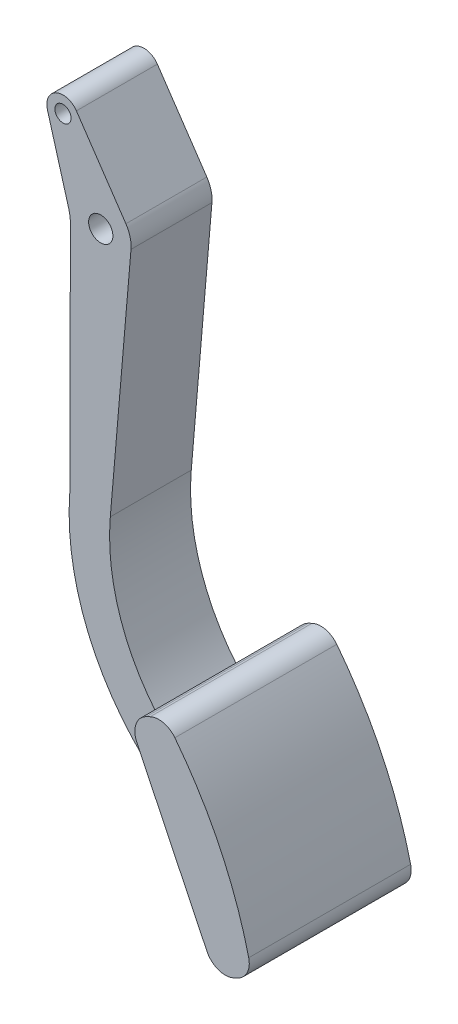
from build123d import *

# Parameters (mm, degrees)
BOSS_EXTRUDE3_DEPTH = 10
BOSS_EXTRUDE4_DEPTH = 20
SKETCH2_R           = 2
SKETCH2_R_2         = 3
CUT_EXTRUDE1_DEPTH  = 40
FILLET3_R           = 10
FILLET4_R           = 10
FILLET5_R           = 5
FILLET6_R           = 5
FILLET7_R           = 5
FILLET8_R           = 5


with BuildPart() as part:
    # Sketch1 → Boss-Extrude3 (new, symmetric)
    with BuildSketch(Plane.XY):
        with BuildLine():
            Line((-6.014924663, 62.244051207), (6.208553437, 44.207596014))
            ThreePointArc((6.208553437, 44.207596014), (7.257156315, 41.893061598), (7.472748917, 39.361232736))
            Line((7.472748917, 39.361232736), (2.362176037, -20.425844843))
            ThreePointArc((2.362176037, -20.425844843), (7.015315923, -46.134373754), (24, -65.986342835))
            Line((24, -65.986342835), (31.161941742, -80.882336991))
            ThreePointArc((31.161941742, -80.882336991), (1.523988114, -56.838882139), (-7.619240262, -19.78625212))
            Line((-7.619240262, -19.78625212), (-7.50208553, 38.961677125))
            Line((-7.50208553, 38.961677125), (-13.173612773, 58.905900119))
            ThreePointArc((-13.173612773, 58.905900119), (-11.01662621, 63.625231148), (-6.014924663, 62.244051207))
        make_face()
        with BuildLine():
            Line((-7.499985087, 40.014956421), (-7.500014913, 40))
            ThreePointArc((-7.500014913, 40), (-7.499996272, 40.007478214), (-7.499985087, 40.014956421))
        make_face(mode=Mode.SUBTRACT)
    extrude(amount=BOSS_EXTRUDE3_DEPTH, both=True)

    # Sketch1<4> → Boss-Extrude4 (add, symmetric)
    with BuildSketch(Plane.XY):
        with BuildLine():
            ThreePointArc((25.760539384, -46.570125255), (39.455220381, -67.725242398), (47.426258953, -91.632266743))
            Line((47.426258953, -91.632266743), (38.413830656, -95.965410657))
            Line((38.413830656, -95.965410657), (31.161941742, -80.882336991))
            Line((31.161941742, -80.882336991), (24, -65.986342835))
            Line((24, -65.986342835), (16.748111086, -50.903269169))
            Line((16.748111086, -50.903269169), (25.760539384, -46.570125255))
        make_face()
    extrude(amount=BOSS_EXTRUDE4_DEPTH, both=True)

    # Sketch2 → Cut-Extrude1 (cut)
    with BuildSketch(Plane.XY.offset(10)):
        with Locations((-9.326153163, 60)):
            Circle(SKETCH2_R)
        with Locations((0, 40)):
            Circle(SKETCH2_R_2)
    extrude(amount=-CUT_EXTRUDE1_DEPTH, mode=Mode.SUBTRACT)

    # Fillet3
    fillet3_edges = [part.edges().sort_by_distance(p)[0] for p in [
        (-7.50208553, 38.961677125, 0),
    ]]
    fillet(fillet3_edges, radius=FILLET3_R)

    # Fillet4
    # the kernel refuses this fillet: 10 mm, written as the material it adds along each edge
    with BuildSketch(Plane(origin=(-7.619240262, -19.78625212, -10), x_dir=(0.0019941894265581785, 0.9999980116022886, 0), z_dir=(0, 0, 1))) as fillet4_piece_1:
        with BuildLine():
            CenterArc((0.38347882, 10), FILLET4_R, 265.770794781, 4.229205219)
            ThreePointArc((-0.353986639, 0.027229838), (-0.176973179, 0.013876746), (0, 0))
            Line((0, 0), (0.38347882, 0))
        make_face()
    extrude(amount=20)

    # Fillet5
    fillet5_edges = [part.edges().sort_by_distance(p)[0] for p in [
        (25.760539384, -46.570125255, 0),
    ]]
    fillet(fillet5_edges, radius=FILLET5_R)

    # Fillet6
    fillet6_edges = [part.edges().sort_by_distance(p)[0] for p in [
        (47.426258953, -91.632266743, 0),
    ]]
    fillet(fillet6_edges, radius=FILLET6_R)

    # Fillet7
    fillet7_edges = [part.edges().sort_by_distance(p)[0] for p in [
        (16.748111086, -50.903269169, 0),
    ]]
    fillet(fillet7_edges, radius=FILLET7_R)

    # Fillet8
    fillet8_edges = [part.edges().sort_by_distance(p)[0] for p in [
        (38.413830656, -95.965410657, 0),
    ]]
    fillet(fillet8_edges, radius=FILLET8_R)


solid = part.part
